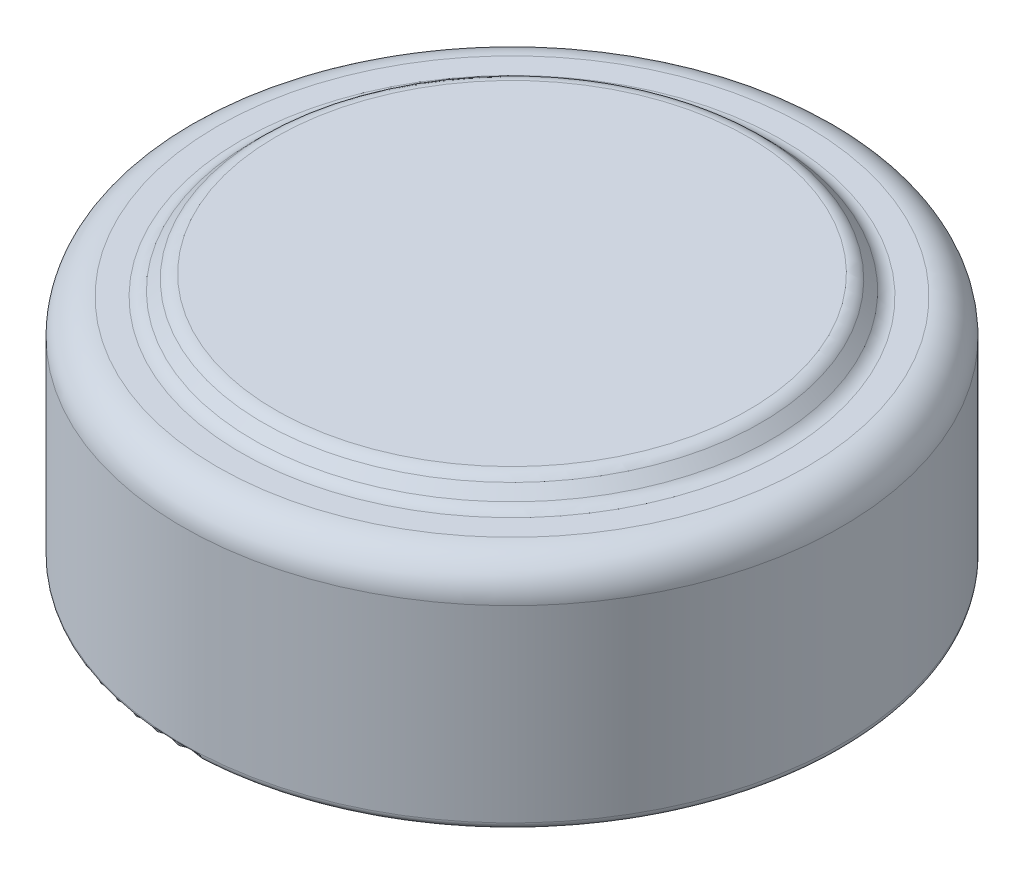
from build123d import *


with BuildPart() as part:
    # Sketch1 → Revolve1 (revolve)
    with BuildSketch(Plane.XY):
        with BuildLine():
            Line((0, 0), (-4.65, 0))
            ThreePointArc((-4.65, 0), (-4.720710678, 0.029289322), (-4.75, 0.1))
            Line((-4.75, 0.1), (-4.75, 2.812))
            ThreePointArc((-4.75, 2.812), (-4.603553391, 3.165553391), (-4.25, 3.312))
            Line((-4.25, 3.312), (-3.903553391, 3.312))
            ThreePointArc((-3.903553391, 3.312), (-3.807882533, 3.331030117), (-3.726776695, 3.385223305))
            Line((-3.726776695, 3.385223305), (-3.585223305, 3.526776695))
            ThreePointArc((-3.585223305, 3.526776695), (-3.504117467, 3.580969883), (-3.408446609, 3.6))
            Line((-3.408446609, 3.6), (0, 3.6))
            Line((0, 3.6), (0, 0))
        make_face()
    revolve(axis=Axis((0, 3.6, 0), (0, -1, 0)))


solid = part.part
